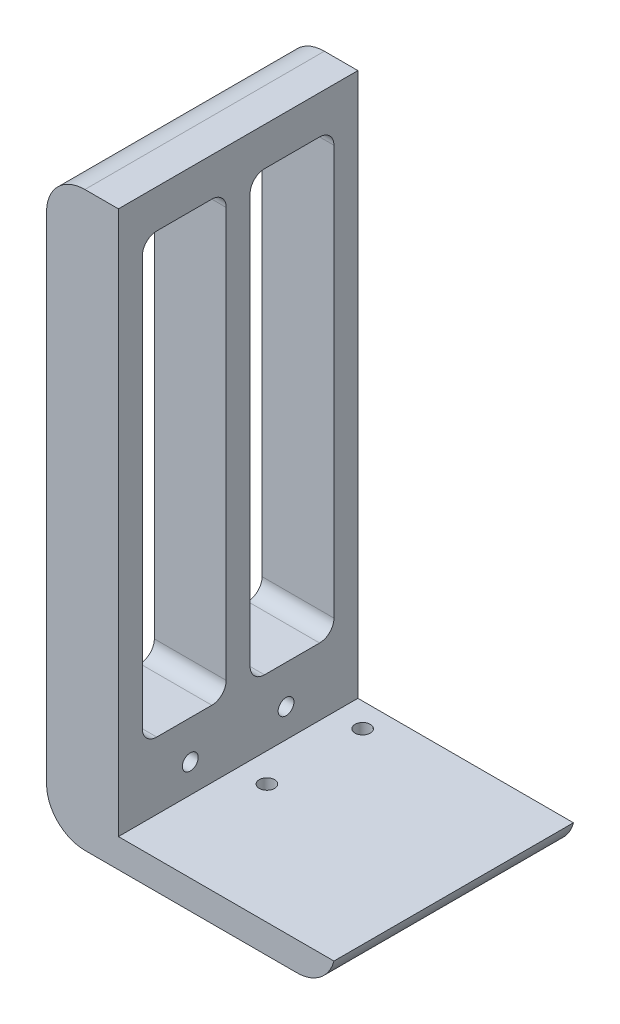
from build123d import *

# Parameters (mm, degrees)
EXTRUDE_1_DEPTH     = 25
FILLET_1_R          = 8
SKETCH_2_R          = 1.65
CUT_EXTRUDE_1_DEPTH = 137.034003102
SKETCH_3_R          = 1.6
CUT_EXTRUDE_2_DEPTH = 131.794686436
SKETCH_4_W          = 17.5
SKETCH_4_H          = 91.5
CUT_EXTRUDE_3_DEPTH = 137.034003102
FILLET_2_R          = 3


with BuildPart() as part:
    # 草图1 → 凸台-拉伸1 (new, symmetric)
    with BuildSketch(Plane.XY):
        Polygon((0, 0), (0, 119.5), (15, 119.5), (15, 6), (60, 6), (60, 0), align=None)
    extrude(amount=EXTRUDE_1_DEPTH, both=True)

    # 圆角1
    # the kernel refuses this fillet: 8 mm, written as the material it takes off along each edge
    with BuildSketch(Plane(origin=(0, 119.5, 45), x_dir=(0, -1, 0), z_dir=(0, 0, -1)), Plane(origin=(0, 0, -45), x_dir=(0, 1, 0), z_dir=(0, 0, 1))) as fillet_1_piece_1:
        with BuildLine():
            CenterArc((FILLET_1_R, -FILLET_1_R), FILLET_1_R, 90, 90)
            Line((0, -FILLET_1_R), (-FILLET_1_R * 0.02, -FILLET_1_R))
            Line((-FILLET_1_R * 0.02, -FILLET_1_R), (-FILLET_1_R * 0.02, FILLET_1_R * 0.02))
            Line((-FILLET_1_R * 0.02, FILLET_1_R * 0.02), (FILLET_1_R, FILLET_1_R * 0.02))
            Line((FILLET_1_R, FILLET_1_R * 0.02), (FILLET_1_R, 0))
        make_face()
    extrude(amount=90, mode=Mode.SUBTRACT)
    with BuildSketch(Plane(origin=(60, 0, -44.364916731), x_dir=(0, 1, 0), z_dir=(0, 0, 1))) as fillet_1_piece_2:
        with BuildLine():
            CenterArc((8, 7.745966692), FILLET_1_R, 180, 75.522487814)
            Line((0, 7.745966692), (-0.16, 7.745966692))
            Line((-0.16, 7.745966692), (-0.16, 0))
            Line((-0.16, 0), (0, -0.16))
            ThreePointArc((0, -0.16), (3, -0.16), (5.96, -0.154919334))
            Line((5.96, -0.154919334), (6, 0))
        make_face()
    extrude(amount=88.729833462, mode=Mode.SUBTRACT)

    # 草图2 → 切除-拉伸1 (cut, through all)
    with BuildSketch(Plane.ZY):
        with Locations((10, 12)):
            Circle(SKETCH_2_R)
        with Locations((-10, 12)):
            Circle(SKETCH_2_R)
    extrude(amount=-CUT_EXTRUDE_1_DEPTH, mode=Mode.SUBTRACT)

    # 草图3 → 切除-拉伸2 (cut, through all)
    with BuildSketch(Plane(origin=(0, 6, 0), x_dir=(1, 0, 0), z_dir=(0, 1, 0))):
        with Locations(Location((21, 0, 0), (0, 0, 270))):
            Circle(SKETCH_3_R)
        with Locations(Location((21, 20, 0), (0, 0, 270))):
            Circle(SKETCH_3_R)
    extrude(amount=-CUT_EXTRUDE_2_DEPTH, mode=Mode.SUBTRACT)

    # 草图4 → 切除-拉伸3 (cut, through all)
    with BuildSketch(Plane.ZY):
        with Locations((-11.25, 65.75)):
            Rectangle(SKETCH_4_W, SKETCH_4_H)
        with Locations((11.25, 65.75)):
            Rectangle(SKETCH_4_W, SKETCH_4_H)
    extrude(amount=-CUT_EXTRUDE_3_DEPTH, mode=Mode.SUBTRACT)

    # 圆角2
    fillet_2_edges = [part.edges().sort_by_distance(p)[0] for p in [
        (7.5, 111.5, -20),
        (7.5, 20, -2.5),
        (7.5, 20, -20),
        (7.5, 111.5, -2.5),
        (7.5, 111.5, 2.5),
        (7.5, 20, 20),
        (7.5, 20, 2.5),
        (7.5, 111.5, 20),
    ]]
    fillet(fillet_2_edges, radius=FILLET_2_R)


solid = part.part
